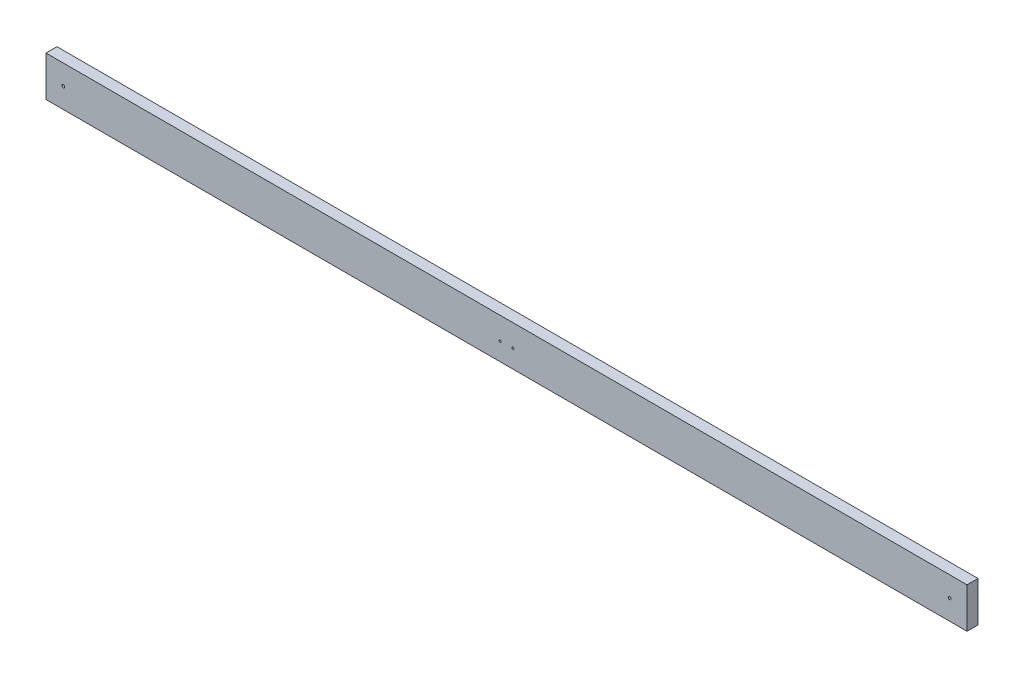
from build123d import *

# Parameters (mm, degrees)
SKETCH1_W           = 3195.32
SKETCH1_H           = 139.7
BOSS_EXTRUDE1_DEPTH = 38.1
SKETCH2_R           = 4.7625
CUT_EXTRUDE1_DEPTH  = 1600.63999328
SKETCH3_R           = 3.571875
CUT_EXTRUDE2_DEPTH  = 1600.63999328


with BuildPart() as part:
    # Sketch1 → Boss-Extrude1 (new body)
    with BuildSketch(Plane.XY):
        Rectangle(SKETCH1_W, SKETCH1_H)
    extrude(amount=BOSS_EXTRUDE1_DEPTH)

    # Sketch2 → Cut-Extrude1 (cut, through all)
    with BuildSketch(Plane.XY.offset(38.1)):
        with Locations((-1537.66, 0)):
            Circle(SKETCH2_R)
        with Locations((1537.66, 0)):
            Circle(SKETCH2_R)
    extrude(amount=-CUT_EXTRUDE1_DEPTH, mode=Mode.SUBTRACT)

    # Sketch3 → Cut-Extrude2 (cut, through all)
    with BuildSketch(Plane.XY.offset(38.1)):
        with Locations((-22.225, -7.8867)):
            Circle(SKETCH3_R)
        with Locations((22.225, -7.8867)):
            Circle(SKETCH3_R)
    extrude(amount=-CUT_EXTRUDE2_DEPTH, mode=Mode.SUBTRACT)


solid = part.part
